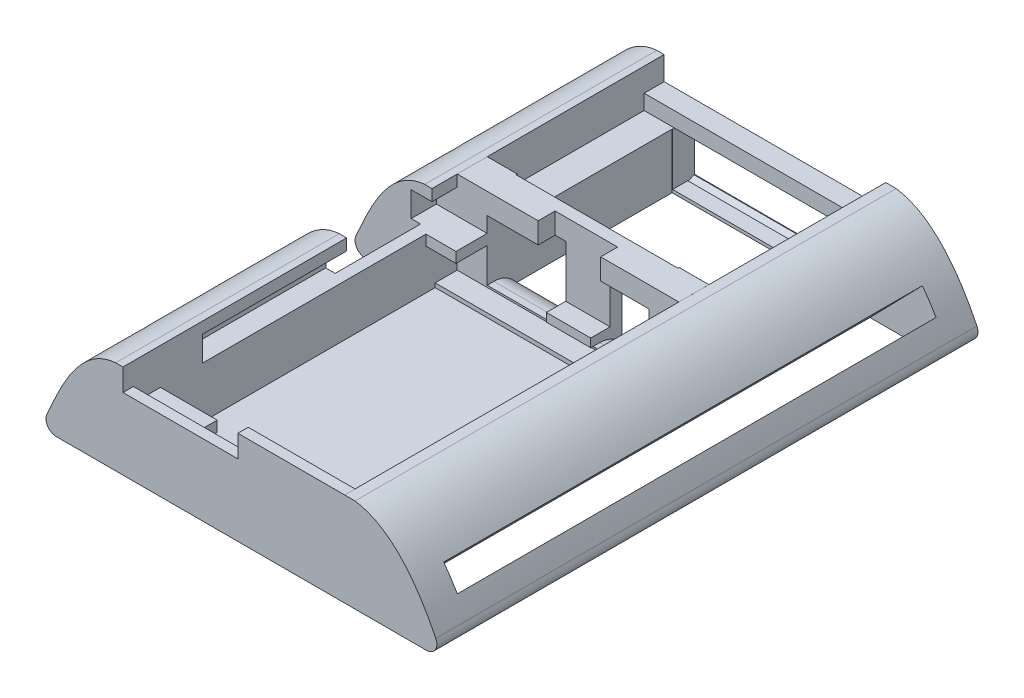
from build123d import *

# Parameters (mm, degrees)
BOSS_EXTRUDE2_DEPTH      = 52
FILLET2_R                = 1
CUT_EXTRUDE2_DEPTH       = 3
CUT_EXTRUDE2_DEPTH_BACK  = 6
SKETCH10_W               = 2.071027546
SKETCH10_H               = 17.5
SKETCH12_W               = 21
SKETCH12_H               = 29
BATTERY_DEPTH            = 0.4
SKETCH14_W               = 21.3
SKETCH14_H               = 1
BOSS_EXTRUDE4_DEPTH      = 7.999920354
FILLET5_R                = 1
SKETCH19_W               = 21.3
SKETCH19_H               = 1
BOSS_EXTRUDE5_DEPTH      = 2.6
SKETCH20_W               = 9.556221564
SKETCH20_H               = 2.6
CUT_EXTRUDE9_DEPTH       = 2.6
SKETCH21_W               = 21.3
SKETCH21_H               = 2.886084762
BOSS_EXTRUDE6_DEPTH      = 8
SKETCH23_W               = 24.481547991
SKETCH23_H               = 2.403526745
CUT_EXTRUDE10_DEPTH      = 2
SKETCH26_W               = 11.036128308
SKETCH26_H               = 2.126226966
CUT_EXTRUDE11_DEPTH      = 2
CUT_EXTRUDE12_DEPTH      = 2
CUT_EXTRUDE12_DEPTH_BACK = 11
SKETCH27_W               = 46
SKETCH27_H               = 2.33
CUT_EXTRUDE15_DEPTH      = 3
CUT_EXTRUDE15_DEPTH_BACK = 2
SKETCH30_W               = 16.027497941
SKETCH30_H               = 8.207966742
SKETCH32_W               = 21.3
SKETCH32_H               = 4.3
BOSS_EXTRUDE7_DEPTH      = 17
SKETCH33_W               = 15.5
SKETCH33_H               = 4.8
CUT_EXTRUDE16_DEPTH      = 17
CUT_EXTRUDE17_DEPTH      = 16
CUT_EXTRUDE17_DEPTH_BACK = 16
SKETCH34_W               = 15.546115034
SKETCH34_H               = 15
CHAMFER1_SIZE            = 2.050303842
CHAMFER1_SIZE_2          = 1
SKETCH36_W               = 1.919218309
SKETCH36_H               = 1.441495618
BOSS_EXTRUDE8_DEPTH      = 24
SKETCH37_W               = 15.546115034
SKETCH37_H               = 5.800639797
CUT_EXTRUDE18_DEPTH      = 3
SKETCH38_W               = 4.259754253
SKETCH38_H               = 3
BOSS_EXTRUDE9_DEPTH      = 7
FILLET6_R                = 2.5
BOSS_EXTRUDE10_DEPTH     = 18
SKETCH41_W               = 2.868853839
SKETCH41_H               = 1
SKETCH41_W_2             = 2.885031127
BOSS_EXTRUDE11_DEPTH     = 3
SKETCH42_W               = 6.004877842
SKETCH42_H               = 3.067097043
CUT_EXTRUDE19_DEPTH      = 7


with BuildPart() as part:
    # Sketch1 → Boss-Extrude2 (new body)
    with BuildSketch(Plane.XY):
        with BuildLine():
            Line((-4.570161627, 0), (-7.263800128, 0))
            add(Edge.make_bspline(
                [(0.042333709, 8.998333002), (-4.213116867, 8.648828695), (-5.985828681, 2.169241543), (-7.263800128, 0)],
                knots=[0, 0, 0, 0, 1, 1, 1, 1], degree=3))
            Line((0.042333709, 8.998333002), (0.742333709, 8.998333002))
            Line((0.742333709, 8.998333002), (0.742333709, 1))
            Line((0.742333709, 1), (22.042333709, 1))
            Line((22.042333709, 1), (22.042333709, 8.998333002))
            Line((22.042333709, 8.998333002), (23.042333709, 8.998333002))
            add(Edge.make_bspline(
                [(23.042333709, 8.998333002), (27.852391375, 8.27132168), (31.467788923, 0)],
                knots=[0, 0, 0, 1, 1, 1], degree=2))
            Line((31.467788923, 0), (26.875523276, 0))
            Line((26.875523276, 0), (22.86911945, 0))
            Line((22.86911945, 0), (0, 0))
            Line((0, 0), (-4.570161627, 0))
        make_face()
    extrude(amount=BOSS_EXTRUDE2_DEPTH)

    # Fillet2
    fillet2_edges = [part.edges().sort_by_distance(p)[0] for p in [
        (-7.263800128, 0, 26),
    ]]
    fillet(fillet2_edges, radius=FILLET2_R)

    # Sketch10 → Cut-Extrude2 (cut, two sides: drawn at the far end of the back side and taken through both)
    with BuildSketch(Plane(origin=(-4.432649633, 3.861619691, 0), x_dir=(0.6568701979277837, 0.7540036757697632, 0), z_dir=(-0.7540036757697632, 0.6568701979277837, 0)).offset(-CUT_EXTRUDE2_DEPTH_BACK)):
        with Locations((-0.442686988, -41.317163409)):
            Rectangle(SKETCH10_W, SKETCH10_H)
        with Locations((-0.442686988, -11.478878468)):
            Rectangle(SKETCH10_W, SKETCH10_H)
    extrude(amount=CUT_EXTRUDE2_DEPTH + CUT_EXTRUDE2_DEPTH_BACK, mode=Mode.SUBTRACT)

    # Sketch12 → Battery (cut)
    with BuildSketch(Plane(origin=(0, 1, 0), x_dir=(1, 0, 0), z_dir=(0, 1, 0))):
        with Locations((11.242333709, -36.5)):
            Rectangle(SKETCH12_W, SKETCH12_H)
    extrude(amount=-BATTERY_DEPTH, mode=Mode.SUBTRACT)

    # Sketch14 → Boss-Extrude4 (add)
    with BuildSketch(Plane(origin=(0, 1, 0), x_dir=(1, 0, 0), z_dir=(0, 1, 0))):
        with Locations((11.392333709, -51.5)):
            Rectangle(SKETCH14_W, SKETCH14_H)
    extrude(amount=BOSS_EXTRUDE4_DEPTH)

    # Fillet5
    fillet5_edges = [part.edges().sort_by_distance(p)[0] for p in [
        (31.467788923, 0, 26),
    ]]
    fillet(fillet5_edges, radius=FILLET5_R)

    # Sketch19 → Boss-Extrude5 (add)
    with BuildSketch(Plane(origin=(0, 0, 51), x_dir=(-1, 0, 0), z_dir=(0, 0, -1))):
        with Locations((-11.392333709, 5)):
            Rectangle(SKETCH19_W, SKETCH19_H)
    extrude(amount=BOSS_EXTRUDE5_DEPTH)

    # Sketch20 → Cut-Extrude9 (cut)
    with BuildSketch(Plane(origin=(0, 5.5, 0), x_dir=(1, 0, 0), z_dir=(0, 1, 0))):
        with Locations((10.971722634, -49.7)):
            Rectangle(SKETCH20_W, SKETCH20_H)
    extrude(amount=-CUT_EXTRUDE9_DEPTH, mode=Mode.SUBTRACT)

    # Sketch21 → Boss-Extrude6 (add)
    with BuildSketch(Plane(origin=(0, 1, 0), x_dir=(1, 0, 0), z_dir=(0, 1, 0))):
        with Locations((11.392333709, -18.443042381)):
            Rectangle(SKETCH21_W, SKETCH21_H)
    extrude(amount=BOSS_EXTRUDE6_DEPTH)

    # Sketch23 → Cut-Extrude10 (cut)
    with BuildSketch(Plane(origin=(0.742333709, 0, 0), x_dir=(0, 0, -1), z_dir=(1, 0, 0))):
        with Locations((-32.126858758, 6.701763373)):
            Rectangle(SKETCH23_W, SKETCH23_H)
    extrude(amount=-CUT_EXTRUDE10_DEPTH, mode=Mode.SUBTRACT)

    # Sketch26 → Cut-Extrude11 (cut)
    with BuildSketch(Plane(origin=(0, 0, 51), x_dir=(-1, 0, 0), z_dir=(0, 0, -1))):
        with Locations((-6.260397863, 7.936806871)):
            Rectangle(SKETCH26_W, SKETCH26_H)
    extrude(amount=-CUT_EXTRUDE11_DEPTH, mode=Mode.SUBTRACT)

    # Sketch27 → Cut-Extrude12 (cut, two sides: drawn at the far end of the back side and taken through both)
    with BuildSketch(Plane(origin=(15.71645511, 16.134429341, 0), x_dir=(0, 0, -1), z_dir=(0.6977674498915984, 0.7163243580053493, 0)).offset(-CUT_EXTRUDE12_DEPTH_BACK)):
        with Locations((-26, -18.013212029)):
            Rectangle(SKETCH27_W, SKETCH27_H)
    extrude(amount=CUT_EXTRUDE12_DEPTH + CUT_EXTRUDE12_DEPTH_BACK, mode=Mode.SUBTRACT)

    # Sketch30 → Cut-Extrude15 (cut, two sides: drawn at the far end of the back side and taken through both)
    with BuildSketch(Plane(origin=(-4.432649633, 3.861619691, 0), x_dir=(0.6568701979277837, 0.7540036757697632, 0), z_dir=(-0.7540036757697632, 0.6568701979277837, 0)).offset(-CUT_EXTRUDE15_DEPTH_BACK)):
        with Locations((1.087669114, -26.408883952)):
            Rectangle(SKETCH30_W, SKETCH30_H)
    extrude(amount=CUT_EXTRUDE15_DEPTH + CUT_EXTRUDE15_DEPTH_BACK, mode=Mode.SUBTRACT)

    # Sketch32 → Boss-Extrude7 (add)
    with BuildSketch(Plane(origin=(0, 0, 0), x_dir=(-1, 0, 0), z_dir=(0, 0, -1))):
        with Locations((-11.392333709, 3.15)):
            Rectangle(SKETCH32_W, SKETCH32_H)
    extrude(amount=-BOSS_EXTRUDE7_DEPTH)

    # Sketch33 → Cut-Extrude16 (cut)
    with BuildSketch(Plane(origin=(0, 0, 0), x_dir=(-1, 0, 0), z_dir=(0, 0, -1))):
        with Locations((-11.42347987, 2.9)):
            Rectangle(SKETCH33_W, SKETCH33_H)
    extrude(amount=-CUT_EXTRUDE16_DEPTH, mode=Mode.SUBTRACT)

    # Sketch34 → Cut-Extrude17 (cut, two sides: drawn at the far end of the back side and taken through both)
    with BuildSketch(Plane(origin=(0, 0.5, 0), x_dir=(1, 0, 0), z_dir=(0, 1, 0)).offset(-CUT_EXTRUDE17_DEPTH_BACK)):
        with Locations((11.400422353, -9.617701537)):
            Rectangle(SKETCH34_W, SKETCH34_H)
    extrude(amount=CUT_EXTRUDE17_DEPTH + CUT_EXTRUDE17_DEPTH_BACK, mode=Mode.SUBTRACT)

    # Chamfer1
    # the kernel refuses this chamfer: 2.050303842, 1 mm, written as the material it takes off along each edge
    with BuildSketch(Plane(origin=(19.17347987, 0.5, 2.117701537), x_dir=(0, 0.016923890849829, -0.9998567807033681), z_dir=(-1, 0, 0))) as chamfer1_piece_1:
        Polygon((CHAMFER1_SIZE * 0.999856780498, CHAMFER1_SIZE * 0.0169238908464), (-CHAMFER1_SIZE_2 * 0.0169238908498, CHAMFER1_SIZE_2 * 0.999856780703), (0, 0), align=None)
    extrude(amount=15.5, mode=Mode.SUBTRACT)

    # Sketch36 → Boss-Extrude8 (add)
    with BuildSketch(Plane(origin=(0.742333709, 0, 0), x_dir=(0, 0, -1), z_dir=(1, 0, 0))):
        with Locations((-0.959609155, 6.020747809)):
            Rectangle(SKETCH36_W, SKETCH36_H)
    extrude(amount=BOSS_EXTRUDE8_DEPTH)

    # Sketch37 → Cut-Extrude18 (cut)
    with BuildSketch(Plane(origin=(0, 0, 17.117701537), x_dir=(-1, 0, 0), z_dir=(0, 0, -1))):
        with Locations((-11.400422353, 4.08463089)):
            Rectangle(SKETCH37_W, SKETCH37_H)
    extrude(amount=-CUT_EXTRUDE18_DEPTH, mode=Mode.SUBTRACT)

    # Sketch38 → Boss-Extrude9 (add)
    with BuildSketch(Plane(origin=(0, 1.184310992, 0), x_dir=(1, 0, 0), z_dir=(0, 1, 0))):
        with Locations((11.677903031, -18.617701537)):
            Rectangle(SKETCH38_W, SKETCH38_H)
    extrude(amount=BOSS_EXTRUDE9_DEPTH)

    # Fillet6
    # the kernel refuses this fillet: 2.5 mm, written as the material it takes off along each edge
    with BuildSketch(Plane(origin=(14.862488739, 1.184310992, 17.117701537), x_dir=(0, -1, 0), z_dir=(-1, 0, 0))) as fillet6_piece_1_section:
        with BuildLine():
            CenterArc((2.5, 2.125785134), FILLET6_R, 180, 58.245844015)
            Line((0, 2.125785134), (-0.05, 2.125785134))
            Line((-0.05, 2.125785134), (-0.05, 0))
            Line((-0.05, 0), (0, -0.05))
            ThreePointArc((0, -0.05), (0.592155496, -0.05), (1.157997212, -0.042515703))
            Line((1.157997212, -0.042515703), (1.184310992, 0))
        make_face()
    fillet6_piece_1 = extrude(amount=11.235123902, mode=Mode.PRIVATE)
    fillet6_piece_1 = split(fillet6_piece_1, bisect_by=Plane(origin=(13.807780157, 0.878026012, 17.652561739), z_dir=(1, 0, 0)), keep=Keep.TOP, mode=Mode.PRIVATE)
    add(fillet6_piece_1, mode=Mode.SUBTRACT)
    with BuildSketch(Plane(origin=(9.548025904, 1.184310992, 17.117701537), x_dir=(0, -1, 0), z_dir=(-1, 0, 0))) as fillet6_piece_2:
        with BuildLine():
            CenterArc((2.5, 2.125785134), FILLET6_R, 180, 58.245844015)
            Line((0, 2.125785134), (-0.05, 2.125785134))
            Line((-0.05, 2.125785134), (-0.05, 0))
            Line((-0.05, 0), (0, -0.05))
            ThreePointArc((0, -0.05), (0.592155496, -0.05), (1.157997212, -0.042515703))
            Line((1.157997212, -0.042515703), (1.184310992, 0))
        make_face()
    extrude(amount=5.920661068, mode=Mode.SUBTRACT)
    with BuildSketch(Plane(origin=(19.17347987, 1.184310992, 17.117701537), x_dir=(0, -1, 0), z_dir=(-1, 0, 0))) as fillet6_piece_3:
        with BuildLine():
            CenterArc((2.5, 2.125785134), FILLET6_R, 180, 58.245844015)
            Line((0, 2.125785134), (-0.05, 2.125785134))
            Line((-0.05, 2.125785134), (-0.05, 0))
            Line((-0.05, 0), (0, -0.05))
            ThreePointArc((0, -0.05), (0.592155496, -0.05), (1.157997212, -0.042515703))
            Line((1.157997212, -0.042515703), (1.184310992, 0))
        make_face()
    extrude(amount=5.365699713, mode=Mode.SUBTRACT)
    with BuildSketch(Plane(origin=(19.17347987, 1.184310992, 17.117701537), x_dir=(0, -1, 0), z_dir=(-1, 0, 0))) as fillet6_piece_4_section:
        with BuildLine():
            CenterArc((2.5, 2.125785134), FILLET6_R, 180, 58.245844015)
            Line((0, 2.125785134), (-0.05, 2.125785134))
            Line((-0.05, 2.125785134), (-0.05, 0))
            Line((-0.05, 0), (0, -0.05))
            ThreePointArc((0, -0.05), (0.592155496, -0.05), (1.157997212, -0.042515703))
            Line((1.157997212, -0.042515703), (1.184310992, 0))
        make_face()
    fillet6_piece_4 = extrude(amount=10.680162547, mode=Mode.PRIVATE)
    fillet6_piece_4 = split(fillet6_piece_4, bisect_by=Plane(origin=(9.548025904, 0.878026012, 17.652561739), z_dir=(-1, 0, 0)), keep=Keep.TOP, mode=Mode.PRIVATE)
    add(fillet6_piece_4, mode=Mode.SUBTRACT)

    # Sketch40 → Boss-Extrude10 (add)
    with BuildSketch(Plane(origin=(3.67347987, 0, 0), x_dir=(0, 0, -1), z_dir=(1, 0, 0))):
        Polygon((-1.194674299, 0), (-2.117701537, 0), (-2.117701537, 0.29858263), (-1.194674299, 0.29858263), (-0.66544558, 0.29858263), (-0.66544558, 0), align=None)
    extrude(amount=BOSS_EXTRUDE10_DEPTH)

    # Sketch41 → Boss-Extrude11 (add)
    with BuildSketch(Plane.XY.offset(19.886084762)):
        with Locations((20.607906789, 5)):
            Rectangle(SKETCH41_W, SKETCH41_H)
        with Locations((2.184849273, 5)):
            Rectangle(SKETCH41_W_2, SKETCH41_H)
    extrude(amount=BOSS_EXTRUDE11_DEPTH)

    # Sketch42 → Cut-Extrude19 (cut)
    with BuildSketch(Plane(origin=(0, 9, 0), x_dir=(1, 0, 0), z_dir=(0, 1, 0))):
        with Locations((11.52664117, -19.791450538)):
            Rectangle(SKETCH42_W, SKETCH42_H)
    extrude(amount=-CUT_EXTRUDE19_DEPTH, mode=Mode.SUBTRACT)


solid = part.part
